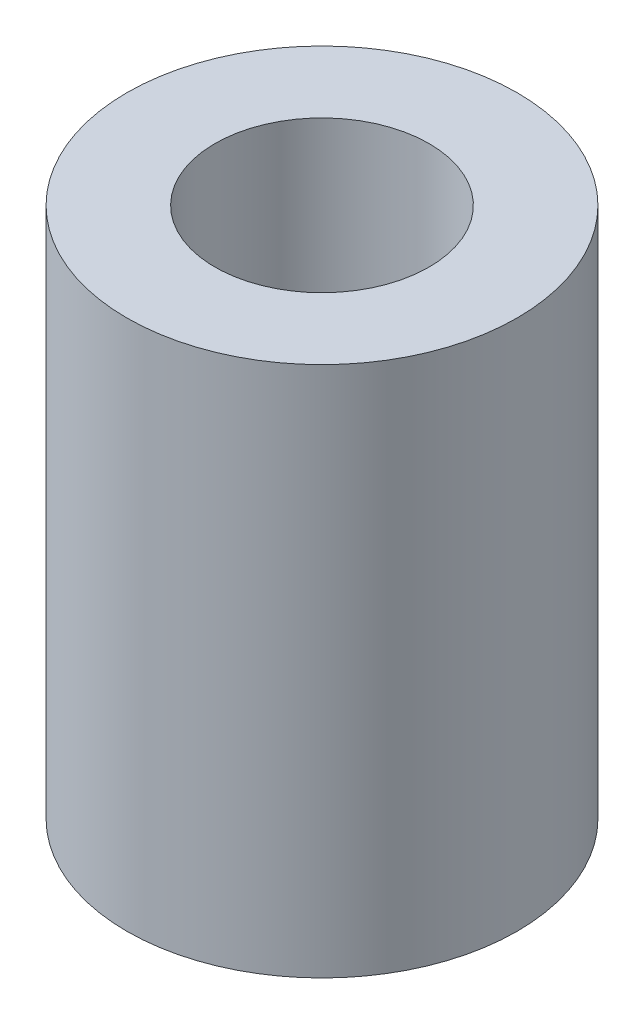
from build123d import *

# Parameters (mm, degrees)
SKETCH1_R           = 2.799145299
SKETCH1_R_2         = 1.5359
BOSS_EXTRUDE1_DEPTH = 7.62


with BuildPart() as part:
    # Sketch1 → Boss-Extrude1 (new body)
    with BuildSketch(Plane(origin=(0, 0, 0), x_dir=(1, 0, 0), z_dir=(0, 1, 0))):
        Circle(SKETCH1_R)
        Circle(SKETCH1_R_2, mode=Mode.SUBTRACT)
    extrude(amount=BOSS_EXTRUDE1_DEPTH)


solid = part.part
